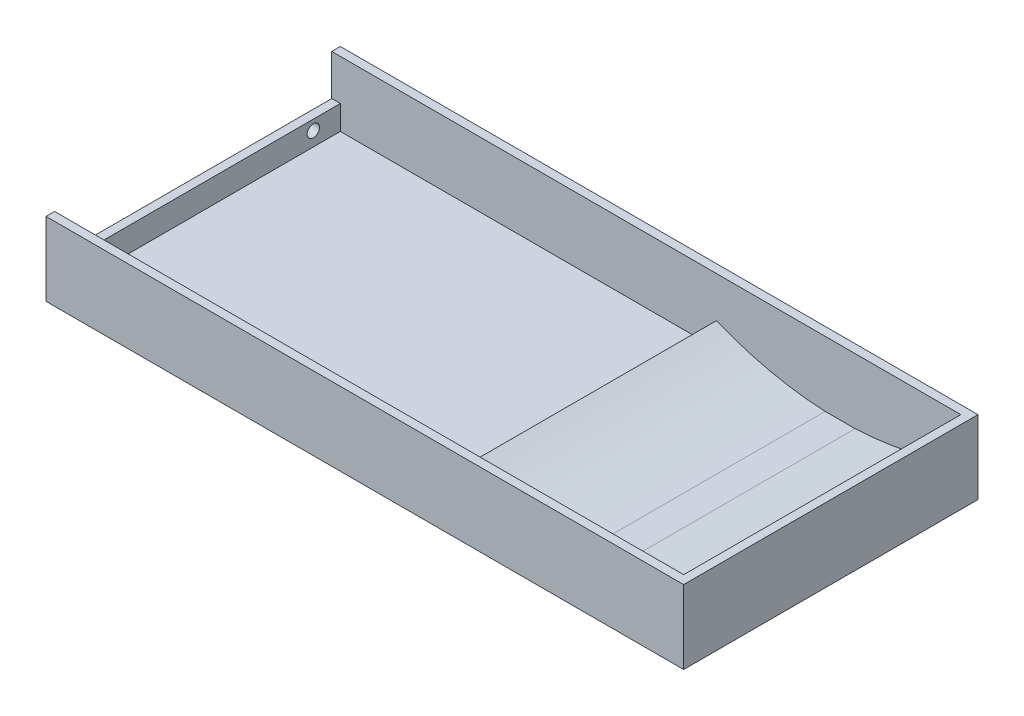
from build123d import *

# Parameters (mm, degrees)
CROQUIS1_W              = 260
CROQUIS1_H              = 120
SALIENTE_EXTRUIR1_DEPTH = 30
VACIADO1_T              = -3.5
SALIENTE_EXTRUIR2_REACH = 179.122
CROQUIS3_W              = 113
CROQUIS3_H              = 24.257897879
CORTAR_EXTRUIR1_DEPTH   = 50.8
CROQUIS4_R              = 2.503701387
CROQUIS4_R_2            = 2.336787961
CORTAR_EXTRUIR2_DEPTH   = 50.8


with BuildPart() as part:
    # Croquis1 → Saliente-Extruir1 (new body)
    with BuildSketch(Plane(origin=(0, 0, 0), x_dir=(1, 0, 0), z_dir=(0, 1, 0))):
        Rectangle(CROQUIS1_W, CROQUIS1_H)
    extrude(amount=SALIENTE_EXTRUIR1_DEPTH)

    # Vaciado1
    vaciado1_openings = [part.faces().sort_by_distance(p)[0] for p in [
        (0, 30, 0),
    ]]
    offset(amount=VACIADO1_T, openings=vaciado1_openings, kind=Kind.INTERSECTION)

    # Croquis2 → Saliente-Extruir2 (add, up to next)
    with BuildSketch(Plane.XY.offset(-56.5), mode=Mode.PRIVATE) as saliente_extruir2_sk1:
        with BuildLine():
            Line((26.853568464, 3.358871314), (77.306419391, 3.358871314))
            ThreePointArc((77.306419391, 3.358871314), (51.589255051, 5.882953779), (26.853568464, 13.358871314))
            Line((26.853568464, 13.358871314), (26.853568464, 3.358871314))
        make_face()
    saliente_extruir2_tool1 = extrude(saliente_extruir2_sk1.sketch, amount=SALIENTE_EXTRUIR2_REACH, mode=Mode.PRIVATE) - part.part
    # Croquis2 → Saliente-Extruir2 (add, up to next)
    with BuildSketch(Plane.XY.offset(-56.5), mode=Mode.PRIVATE) as saliente_extruir2_sk2:
        with BuildLine():
            ThreePointArc((126.5, 12.846828341), (105.349686421, 6.365747469), (83.415063898, 3.5))
            Line((83.415063898, 3.5), (126.5, 3.5))
            Line((126.5, 3.5), (126.5, 12.846828341))
        make_face()
    saliente_extruir2_tool2 = extrude(saliente_extruir2_sk2.sketch, amount=SALIENTE_EXTRUIR2_REACH, mode=Mode.PRIVATE) - part.part
    add(saliente_extruir2_tool1.solids().sort_by_distance((39.369452, 6.338377, -56.5))[0])
    add(saliente_extruir2_tool2.solids().sort_by_distance((114.741247, 6.306435, -56.5))[0])

    # Croquis3 → Cortar-Extruir1 (cut)
    with BuildSketch(Plane.ZY.offset(130)):
        with Locations((0, 25.487820254)):
            Rectangle(CROQUIS3_W, CROQUIS3_H)
    extrude(amount=-CORTAR_EXTRUIR1_DEPTH, mode=Mode.SUBTRACT)

    # Croquis4 → Cortar-Extruir2 (cut)
    with BuildSketch(Plane.ZY.offset(130)):
        with Locations((-45.483908525, 9.241486811)):
            Circle(CROQUIS4_R)
        with Locations((38.97428492, 9.241486811)):
            Circle(CROQUIS4_R_2)
    extrude(amount=-CORTAR_EXTRUIR2_DEPTH, mode=Mode.SUBTRACT)


solid = part.part
